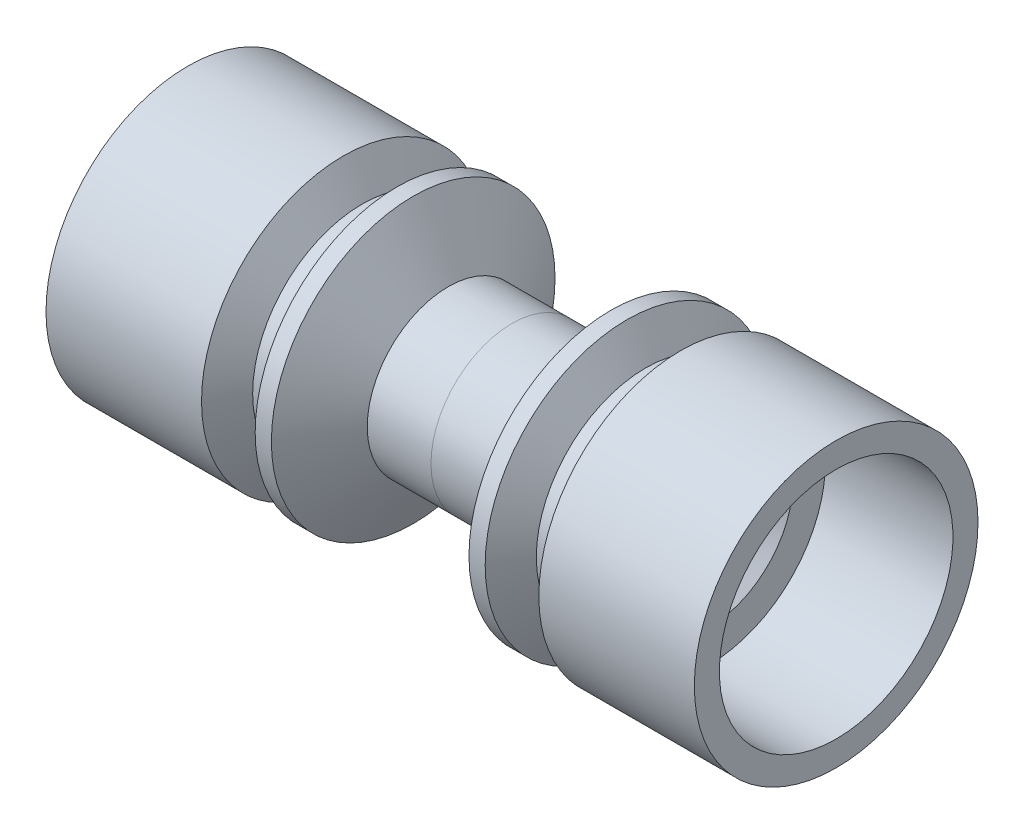
from build123d import *

# Parameters (mm, degrees)
CHAMFER1_SIZE = 0.508


with BuildPart() as part:
    # Sketch2 → Revolve1 (revolve)
    with BuildSketch(Plane.XY):
        Polygon((-6.606984842, 5.55625), (-12.7, 5.55625), (-12.7, 4.575), (-7.7, 4.575), (-7.7, 3.305), (-7.192, 2.797), (-7.192, 1.7145), (-2.875, 1.7145), (-2.875, 1.6), (0, 1.6), (0, 3.175), (-2.49569983, 3.175), (-3.870515158, 5.55625), (-4.505515158, 5.55625), (-5.23875, 4.28625), (-5.87375, 4.28625), align=None)
    revolve(axis=Axis((-12.7, 0, 0), (1, 0, 0)))


with BuildPart() as body_2:
    # Mirror1: mirrored copy
    add(part.part.mirror(Plane(origin=(0, 0, 0), x_dir=(0, 0, 1), z_dir=(1, 0, 0))))


with BuildPart() as part_1:
    add(part.part)

    # Chamfer1
    chamfer1_edges = [part_1.edges().sort_by_distance(p)[0] for p in [
        (-12.7, -4.575, 0),
    ]]
    chamfer(chamfer1_edges, length=CHAMFER1_SIZE)


solid = Compound([body_2.part, part_1.part])
